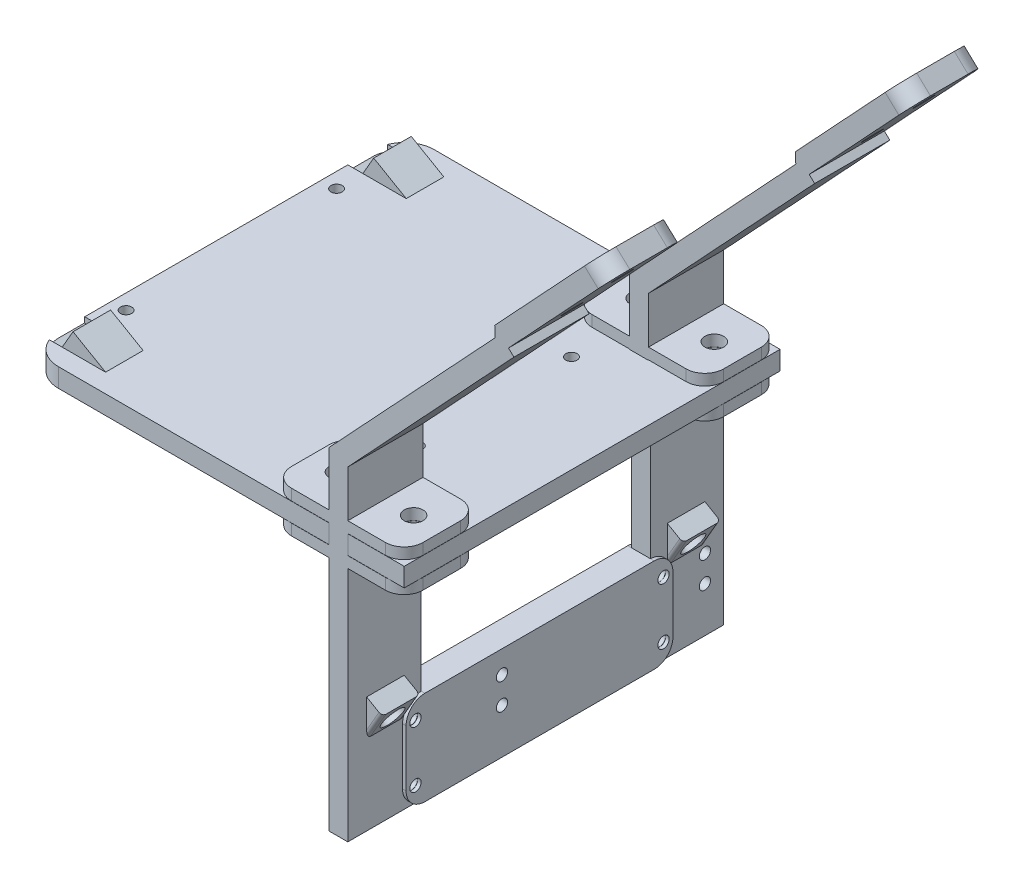
from build123d import *

# Parameters (mm, degrees)
BOSS_EXTRUDE1_DEPTH      = 177
SKETCH2_W                = 38.5
SKETCH2_H                = 131.411442955
CUT_EXTRUDE1_DEPTH       = 149
SKETCH3_R                = 1.5
CUT_EXTRUDE2_DEPTH       = 10
SKETCH4_W                = 20
SKETCH4_H                = 5
SKETCH4_W_2              = 80
BOSS_EXTRUDE2_DEPTH      = 50
SKETCH6_W                = 51.237784488
SKETCH6_H                = 73.001467873
CUT_EXTRUDE4_DEPTH       = 30
BOSS_EXTRUDE3_DEPTH      = 20
FILLET1_R                = 8
CUT_EXTRUDE5_DEPTH       = 251.361711368
SKETCH9_R                = 5
CUT_EXTRUDE6_DEPTH       = 3
SKETCH10_R               = 2.5
CUT_EXTRUDE7_DEPTH       = 235.893114528
FILLET2_R                = 5
SKETCH11_W               = 61
SKETCH11_H               = 41
CUT_EXTRUDE8_DEPTH       = 191.999951248
SKETCH13_R               = 2.5
BOSS_EXTRUDE4_DEPTH      = 3
BOSS_EXTRUDE5_DEPTH      = 5
SKETCH15_R               = 3
CUT_EXTRUDE10_DEPTH      = 231.810012314
SKETCH16_W               = 10
SKETCH16_H               = 9
CUT_EXTRUDE11_DEPTH      = 10
SKETCH17_W               = 10
SKETCH17_H               = 9
SKETCH17_R               = 3
BOSS_EXTRUDE6_DEPTH      = 5
SKETCH18_R               = 1.5
CUT_EXTRUDE12_DEPTH      = 195.856456522
SKETCH19_W               = 9.95
SKETCH19_H               = 0.05
SKETCH19_W_2             = 5
SKETCH19_W_3             = 0.05
SKETCH19_H_2             = 5
CUT_EXTRUDE14_DEPTH      = 20
CUT_EXTRUDE15_DEPTH      = 195.856456522
CUT_EXTRUDE15_DEPTH_BACK = 20
SKETCH13_2_R             = 2.5
CUT_EXTRUDE16_DEPTH      = 251.361711368
CHAMFER1_SIZE            = 2
CUT_EXTRUDE17_DEPTH      = 25
SKETCH24_R               = 1.5
CUT_EXTRUDE18_DEPTH      = 50
SKETCH25_R               = 1.5
BOSS_EXTRUDE7_DEPTH      = 1
FILLET3_R                = 1
CUT_EXTRUDE19_START      = -25
CUT_EXTRUDE19_DEPTH      = 25


# Read off the part's stored shape, not the designer's step: Cut-Extrude19
# Some blends are built 0.0001 mm under size
with BuildPart() as part:
    # Sketch1 → Boss-Extrude1 (new body)
    with BuildSketch(Plane.XY.offset(88.5)):
        Polygon((-30.689926203, -30.910916573), (-27.033157695, -34.320908373), (-73.429811407, -84.075228064), (-73.429811407, -166.075228064), (-78.429811407, -166.075228064), (-78.429811407, -82.105675686), align=None)
    extrude(amount=-BOSS_EXTRUDE1_DEPTH)

    # Sketch2 → Cut-Extrude1 (cut)
    with BuildSketch(Plane(origin=(-0.99756405, 0.930243526, 0), x_dir=(0, 0, 1), z_dir=(-0.7313537016191676, 0.6819983600625017, 0))):
        with Locations((-69.25, -109.243014075)):
            Rectangle(SKETCH2_W, SKETCH2_H)
        with Locations((69.25, -109.243014075)):
            Rectangle(SKETCH2_W, SKETCH2_H)
    extrude(amount=-CUT_EXTRUDE1_DEPTH, mode=Mode.SUBTRACT)

    # Sketch3 → Cut-Extrude2 (cut)
    with BuildSketch(Plane(origin=(-73.429811407, 0, 0), x_dir=(0, 0, -1), z_dir=(1, 0, 0))):
        with Locations(Location((45, -147.075228064, 0), (0, 0, 90))):
            Circle(SKETCH3_R)
        with Locations(Location((45, -154.075228064, 0), (0, 0, 90))):
            Circle(SKETCH3_R)
        with Locations(Location((-10, -147.075228064, 0), (0, 0, 90))):
            Circle(SKETCH3_R)
        with Locations(Location((-10, -154.075228064, 0), (0, 0, 90))):
            Circle(SKETCH3_R)
    extrude(amount=-CUT_EXTRUDE2_DEPTH, mode=Mode.SUBTRACT)

    # Sketch4 → Boss-Extrude2 (add, symmetric)
    with BuildSketch(Plane.XY):
        with Locations((-68.429811407, -97.575228064)):
            Rectangle(SKETCH4_W, SKETCH4_H)
        with Locations((-118.429811407, -97.575228064)):
            Rectangle(SKETCH4_W_2, SKETCH4_H)
    extrude(amount=BOSS_EXTRUDE2_DEPTH, both=True)

    # Sketch6 → Cut-Extrude4 (cut, symmetric)
    with BuildSketch(Plane.XY):
        with Locations((-52.810919163, -58.574494128)):
            Rectangle(SKETCH6_W, SKETCH6_H)
    extrude(amount=CUT_EXTRUDE4_DEPTH, both=True, mode=Mode.SUBTRACT)

    # Sketch7 → Boss-Extrude3 (add)
    with BuildSketch(Plane.XY.offset(50)):
        Polygon((-78.429811407, -74.774279758), (-78.429811407, -82.105675686), (-30.689926203, -30.910916573), (-3.4099918, -1.656768508), (-7.066760308, 1.753223292), align=None)
    boss_extrude3 = extrude(amount=-BOSS_EXTRUDE3_DEPTH)

    # Mirror2: Boss-Extrude3 across plane
    add(boss_extrude3.mirror(Plane.XY))

    # Fillet1
    fillet1_edges = [part.edges().sort_by_distance(p)[0] for p in [
        (-158.429811407, -97.575228064, 50),
        (-158.429811407, -97.575228064, -50),
    ]]
    fillet(fillet1_edges, radius=FILLET1_R)

    # Sketch8 → Cut-Extrude5 (cut, through all)
    with BuildSketch(Plane(origin=(0, 0, -50), x_dir=(-1, 0, 0), z_dir=(0, 0, -1))):
        Polygon((73.429811407, -79.676390507), (29.2272188, -32.274913293), (27.033157695, -34.320908373), (73.429811407, -84.075228064), align=None)
    extrude(amount=-CUT_EXTRUDE5_DEPTH, mode=Mode.SUBTRACT)

    # Sketch9 → Cut-Extrude6 (cut)
    with BuildSketch(Plane(origin=(-4.654332558, 4.340235327, 0), x_dir=(0, 0, 1), z_dir=(-0.7313537016191722, 0.6819983600624966, 0))):
        with Locations(Location((-40, -13.537292597, 0), (0, 0, 270))):
            Circle(SKETCH9_R)
        with Locations(Location((-40, -33.537292597, 0), (0, 0, 270))):
            Circle(SKETCH9_R)
        with Locations(Location((40, -33.537292597, 0), (0, 0, 270))):
            Circle(SKETCH9_R)
        with Locations(Location((40, -13.537292597, 0), (0, 0, 270))):
            Circle(SKETCH9_R)
    extrude(amount=-CUT_EXTRUDE6_DEPTH, mode=Mode.SUBTRACT)

    # Sketch10 → Cut-Extrude7 (cut, through all)
    with BuildSketch(Plane(origin=(-2.460271453, 2.294240246, 0), x_dir=(0, 0, 1), z_dir=(-0.7313537016191722, 0.6819983600624966, 0))):
        with Locations(Location((-40, -13.537292597, 0), (0, 0, 270))):
            Circle(SKETCH10_R)
        with Locations(Location((-40, -33.537292597, 0), (0, 0, 270))):
            Circle(SKETCH10_R)
        with Locations(Location((40, -13.537292597, 0), (0, 0, 270))):
            Circle(SKETCH10_R)
        with Locations(Location((40, -33.537292597, 0), (0, 0, 270))):
            Circle(SKETCH10_R)
    extrude(amount=-CUT_EXTRUDE7_DEPTH, mode=Mode.SUBTRACT)

    # Fillet2
    fillet2_edges = [part.edges().sort_by_distance(p)[0] for p in [
        (-5.238376054, 0.048227392, 50),
        (-5.238376054, 0.048227392, 30),
        (-5.238376054, 0.048227392, -30),
        (-5.238376054, 0.048227392, -50),
    ]]
    fillet(fillet2_edges, radius=FILLET2_R)

    # Sketch11 → Cut-Extrude8 (cut, through all)
    with BuildSketch(Plane.ZY.offset(78.429811407)):
        with Locations((0, -120.575228064)):
            Rectangle(SKETCH11_W, SKETCH11_H)
    extrude(amount=-CUT_EXTRUDE8_DEPTH, mode=Mode.SUBTRACT)

    # Sketch13 → Boss-Extrude4 (add)
    # profile 1 of 2: a face of its own
    with BuildSketch(Plane.XZ.offset(100.075228064)):
        with BuildLine():
            Line((-63.429811407, 50), (-88.429811407, 50))
            ThreePointArc((-88.429811407, 50), (-91.965345313, 48.535533906), (-93.429811407, 45))
            Line((-93.429811407, 45), (-93.429811407, 35))
            ThreePointArc((-93.429811407, 35), (-91.965345313, 31.464466094), (-88.429811407, 30))
            Line((-88.429811407, 30), (-63.429811407, 30))
            ThreePointArc((-63.429811407, 30), (-59.894277501, 31.464466094), (-58.429811407, 35))
            Line((-58.429811407, 35), (-58.429811407, 45))
            ThreePointArc((-58.429811407, 45), (-59.894277501, 48.535533906), (-63.429811407, 50))
        make_face()
        with Locations(Location((-65.929811407, 40, 0), (0, 0, 270))):
            Circle(SKETCH13_R, mode=Mode.SUBTRACT)
        with Locations(Location((-85.929811407, 40, 0), (0, 0, 270))):
            Circle(SKETCH13_R, mode=Mode.SUBTRACT)
    # profile 2 of 2: a face of its own
    with BuildSketch(Plane.XZ.offset(100.075228064)):
        with BuildLine():
            Line((-63.429811407, -30), (-88.429811407, -30))
            ThreePointArc((-88.429811407, -30), (-91.965345313, -31.464466094), (-93.429811407, -35))
            Line((-93.429811407, -35), (-93.429811407, -45))
            ThreePointArc((-93.429811407, -45), (-91.965345313, -48.535533906), (-88.429811407, -50))
            Line((-88.429811407, -50), (-63.429811407, -50))
            ThreePointArc((-63.429811407, -50), (-59.894277501, -48.535533906), (-58.429811407, -45))
            Line((-58.429811407, -45), (-58.429811407, -35))
            ThreePointArc((-58.429811407, -35), (-59.894277501, -31.464466094), (-63.429811407, -30))
        make_face()
        with Locations(Location((-65.929811407, -40, 0), (0, 0, 90))):
            Circle(SKETCH13_R, mode=Mode.SUBTRACT)
        with Locations(Location((-85.929811407, -40, 0), (0, 0, 90))):
            Circle(SKETCH13_R, mode=Mode.SUBTRACT)
    boss_extrude4 = extrude(amount=BOSS_EXTRUDE4_DEPTH)

    # Mirror3: Boss-Extrude4 across plane
    add(boss_extrude4.mirror(Plane.ZX.offset(-97.575228064)))

    # Sketch14 → Boss-Extrude5 (add, symmetric)
    with BuildSketch(Plane.XY.offset(40)):
        Polygon((-154.429811407, -95.075228064), (-142.882806023, -95.075228064), (-151.543060061, -90.075228064), align=None)
    boss_extrude5 = extrude(amount=BOSS_EXTRUDE5_DEPTH, both=True)

    # Sketch15 → Cut-Extrude10 (cut, through all)
    with BuildSketch(Plane(origin=(-74.653577168, 43.101262874, 0), x_dir=(0, 0, 1), z_dir=(-0.8660254037844434, 0.499999999999992, 0))):
        with Locations(Location((40, -158.278965786, 0), (0, 0, 270))):
            Circle(SKETCH15_R)
    cut_extrude10 = extrude(amount=-CUT_EXTRUDE10_DEPTH, mode=Mode.SUBTRACT)

    # Sketch16 → Cut-Extrude11 (cut)
    with BuildSketch(Plane(origin=(-74.653577168, 43.101262874, 0), x_dir=(0, 0, 1), z_dir=(-0.8660254037844434, 0.499999999999992, 0))):
        with Locations((40, -158.278965786)):
            Rectangle(SKETCH16_W, SKETCH16_H)
    cut_extrude11 = extrude(amount=CUT_EXTRUDE11_DEPTH, mode=Mode.SUBTRACT)

    # Sketch17 → Boss-Extrude6 (add)
    with BuildSketch(Plane(origin=(3.288709172, -1.898737126, 0), x_dir=(0, 0, 1), z_dir=(-0.8660254037844434, 0.499999999999992, 0))):
        with Locations((40, -158.278965786)):
            Rectangle(SKETCH17_W, SKETCH17_H)
        with Locations(Location((40, -158.278965786, 0), (0, 0, 270))):
            Circle(SKETCH17_R, mode=Mode.SUBTRACT)
    boss_extrude6 = extrude(amount=-BOSS_EXTRUDE6_DEPTH)

    # Mirror4: Boss-Extrude5, Cut-Extrude10, Cut-Extrude11, Boss-Extrude6 across plane
    add(boss_extrude5.mirror(Plane.XY))
    add(cut_extrude10.mirror(Plane.XY), mode=Mode.SUBTRACT)
    add(cut_extrude11.mirror(Plane.XY), mode=Mode.SUBTRACT)
    add(boss_extrude6.mirror(Plane.XY))

    # Sketch18 → Cut-Extrude12 (cut, through all)
    with BuildSketch(Plane.XZ.offset(100.075228064)):
        with Locations(Location((-154.429811407, 28, 0), (0, 0, 270))):
            Circle(SKETCH18_R)
        with Locations(Location((-84.429811407, 20.5, 0), (0, 0, 270))):
            Circle(SKETCH18_R)
        with Locations(Location((-84.429811407, -20.5, 0), (0, 0, 180))):
            Circle(SKETCH18_R)
        with Locations(Location((-154.429811407, -28, 0), (0, 0, 180))):
            Circle(SKETCH18_R)
    extrude(amount=-CUT_EXTRUDE12_DEPTH, mode=Mode.SUBTRACT)

    # Sketch19 → Cut-Extrude14 (cut)
    with BuildSketch(Plane(origin=(0, 0, -50), x_dir=(-1, 0, 0), z_dir=(0, 0, -1))):
        with Locations((68.404811407, -95.050228064)):
            Rectangle(SKETCH19_W, SKETCH19_H)
        with Locations((60.929811407, -95.050228064)):
            Rectangle(SKETCH19_W_2, SKETCH19_H)
        with Locations((60.929811407, -100.100228064)):
            Rectangle(SKETCH19_W_2, SKETCH19_H)
        with Locations((68.404811407, -100.100228064)):
            Rectangle(SKETCH19_W, SKETCH19_H)
        with Locations((73.404811407, -95.050228064)):
            Rectangle(SKETCH19_W_3, SKETCH19_H)
        with Locations((73.404811407, -97.575228064)):
            Rectangle(SKETCH19_W_3, SKETCH19_H_2)
        with Locations((73.404811407, -100.100228064)):
            Rectangle(SKETCH19_W_3, SKETCH19_H)
        with Locations((83.454811407, -100.100228064)):
            Rectangle(SKETCH19_W, SKETCH19_H)
        with Locations((78.454811407, -100.100228064)):
            Rectangle(SKETCH19_W_3, SKETCH19_H)
        with Locations((78.454811407, -97.575228064)):
            Rectangle(SKETCH19_W_3, SKETCH19_H_2)
        with Locations((78.454811407, -95.050228064)):
            Rectangle(SKETCH19_W_3, SKETCH19_H)
        with Locations((83.454811407, -95.050228064)):
            Rectangle(SKETCH19_W, SKETCH19_H)
        with Locations((90.929811407, -95.050228064)):
            Rectangle(SKETCH19_W_2, SKETCH19_H)
        with Locations((90.929811407, -100.100228064)):
            Rectangle(SKETCH19_W_2, SKETCH19_H)
    cut_extrude14 = extrude(amount=-CUT_EXTRUDE14_DEPTH, mode=Mode.SUBTRACT)

    # Mirror6: Cut-Extrude14 across plane
    add(cut_extrude14.mirror(Plane.XY), mode=Mode.SUBTRACT)

    # Sketch13<2> → Cut-Extrude15 (cut, two sides: drawn at the far end of the back side and taken through both)
    with BuildSketch(Plane.XZ.offset(100.075228064).offset(-CUT_EXTRUDE15_DEPTH_BACK)):
        with Locations(Location((-85.929811407, 40, 0), (0, 0, 90))):
            Circle(SKETCH13_2_R)
        with Locations(Location((-65.929811407, 40, 0), (0, 0, 90))):
            Circle(SKETCH13_2_R)
        with Locations(Location((-85.929811407, -40, 0), (0, 0, 90))):
            Circle(SKETCH13_2_R)
        with Locations(Location((-65.929811407, -40, 0), (0, 0, 90))):
            Circle(SKETCH13_2_R)
    extrude(amount=CUT_EXTRUDE15_DEPTH + CUT_EXTRUDE15_DEPTH_BACK, mode=Mode.SUBTRACT)

    # Sketch22 → Cut-Extrude16 (cut, through all)
    with BuildSketch(Plane(origin=(0, 0, -50), x_dir=(-1, 0, 0), z_dir=(0, 0, -1))):
        Polygon((34.346694711, -27.500924773), (32.883987308, -28.864921493), (76.967104004, -76.138276478), (78.429811407, -77.706838129), (78.429811407, -74.774279758), align=None)
    extrude(amount=-CUT_EXTRUDE16_DEPTH, mode=Mode.SUBTRACT)

    # Chamfer1
    chamfer1_edges = [part.edges().sort_by_distance(p)[0] for p in [
        (-32.883987308, -28.864921493, 40),
        (-32.883987308, -28.864921493, -40),
    ]]
    chamfer(chamfer1_edges, length=CHAMFER1_SIZE - 0.0001)  # a hair under: the kernel refuses the full size

    # Sketch23 → Cut-Extrude17 (cut, symmetric)
    with BuildSketch(Plane(origin=(0, -95.075228064, 0), x_dir=(1, 0, 0), z_dir=(0, 1, 0))):
        Polygon((-73.379811407, -30), (-73.379811407, -29.95), (-78.479811407, -29.95), (-78.479811407, -30), (-78.429811407, -30), (-73.429811407, -30), align=None)
        Polygon((-73.379811407, 30), (-73.379811407, 29.95), (-78.479811407, 29.95), (-78.479811407, 30), (-78.429811407, 30), (-73.429811407, 30), align=None)
    extrude(amount=CUT_EXTRUDE17_DEPTH, both=True, mode=Mode.SUBTRACT)


with BuildPart() as cut_extrude17_piece_1:
    # of the separate pieces the step leaves, piece 1, a body of its own (cut_extrude17_pieces)
    add(part.part.solids().sort_by_distance((-34.247915828, -30.327555761, -50))[0])

    # Sketch24 → Cut-Extrude18 (cut)
    with BuildSketch(Plane.ZY.offset(78.429811407)):
        with Locations(Location((-33, -146.075228064, 0), (0, 0, 270))):
            Circle(SKETCH24_R)
        with Locations(Location((-33, -161.075228064, 0), (0, 0, 270))):
            Circle(SKETCH24_R)
        with Locations(Location((33, -161.075228064, 0), (0, 0, 270))):
            Circle(SKETCH24_R)
        with Locations(Location((33, -146.075228064, 0), (0, 0, 270))):
            Circle(SKETCH24_R)
    extrude(amount=-CUT_EXTRUDE18_DEPTH, mode=Mode.SUBTRACT)

    # Sketch25 → Boss-Extrude7 (add)
    with BuildSketch(Plane.ZY.offset(78.429811407)):
        with BuildLine():
            Line((-30.5, -141.075228064), (30.5, -141.075228064))
            ThreePointArc((30.5, -141.075228064), (34.035533906, -142.539694158), (35.5, -146.075228064))
            Line((35.5, -146.075228064), (35.5, -161.075228064))
            ThreePointArc((35.5, -161.075228064), (34.035533906, -164.61076197), (30.5, -166.075228064))
            Line((30.5, -166.075228064), (-30.5, -166.075228064))
            ThreePointArc((-30.5, -166.075228064), (-34.035533906, -164.61076197), (-35.5, -161.075228064))
            Line((-35.5, -161.075228064), (-35.5, -146.075228064))
            ThreePointArc((-35.5, -146.075228064), (-34.035533906, -142.539694158), (-30.5, -141.075228064))
        make_face()
        with Locations(Location((-33, -146.075228064, 0), (0, 0, 270))):
            Circle(SKETCH25_R, mode=Mode.SUBTRACT)
        with Locations(Location((-33, -161.075228064, 0), (0, 0, 270))):
            Circle(SKETCH25_R, mode=Mode.SUBTRACT)
        with Locations(Location((33, -146.075228064, 0), (0, 0, 270))):
            Circle(SKETCH25_R, mode=Mode.SUBTRACT)
        with Locations(Location((33, -161.075228064, 0), (0, 0, 270))):
            Circle(SKETCH25_R, mode=Mode.SUBTRACT)
        with Locations(Location((10, -147.075228064, 0), (0, 0, 90))):
            Circle(SKETCH25_R, mode=Mode.SUBTRACT)
        with Locations(Location((10, -154.075228064, 0), (0, 0, 90))):
            Circle(SKETCH25_R, mode=Mode.SUBTRACT)
    boss_extrude7 = extrude(amount=BOSS_EXTRUDE7_DEPTH)

    # Mirror7: Boss-Extrude7 across plane
    add(boss_extrude7.mirror(Plane(origin=(-75.929811407, 0, 0), x_dir=(0, 0, 1), z_dir=(1, 0, 0))))

    # Fillet3
    # the kernel refuses this fillet: 1 mm, written as the material it takes off along each edge
    with BuildSketch(Plane(origin=(-74.169818251, -146.060842102, -35), x_dir=(-0.8660254037844433, 0.49999999999999195, 0), z_dir=(0.499999999999992, 0.8660254037844434, 0))) as fillet3_piece_1_section:
        with BuildLine():
            CenterArc((FILLET3_R, -FILLET3_R), FILLET3_R, 90, 90)
            Line((0, -FILLET3_R), (0, 0))
            Line((0, 0), (FILLET3_R, 0))
        make_face()
    fillet3_piece_1 = extrude(amount=12.298343098, mode=Mode.PRIVATE)
    fillet3_piece_1 = split(fillet3_piece_1, bisect_by=Plane(origin=(-73.429811407, -139.757269154, -35.233121539), z_dir=(1, 0, 0)), keep=Keep.TOP, mode=Mode.PRIVATE)
    fillet3_piece_1 = fillet3_piece_1 - Plane(origin=(-70.784836238, -146.075228064, -30.5), x_dir=(0, 0, -1), z_dir=(-1, 0, 0)) * Cylinder(5, 29, mode=Mode.PRIVATE)
    add(fillet3_piece_1, mode=Mode.SUBTRACT)
    with BuildSketch(Plane(origin=(-68.020646702, -135.410164555, -45), x_dir=(-0.8660254037844433, 0.4999999999999919, 0), z_dir=(-0.499999999999992, -0.8660254037844434, 0))) as fillet3_piece_2_section:
        with BuildLine():
            CenterArc((FILLET3_R, -FILLET3_R), FILLET3_R, 90, 90)
            Line((0, -FILLET3_R), (0, 0))
            Line((0, 0), (FILLET3_R, 0))
        make_face()
    fillet3_piece_2 = extrude(amount=13.318329411, mode=Mode.PRIVATE)
    fillet3_piece_2 = split(fillet3_piece_2, bisect_by=Plane(origin=(-73.429811407, -139.821295864, -44.769043645), z_dir=(1, 0, 0)), keep=Keep.TOP, mode=Mode.PRIVATE)
    add(fillet3_piece_2, mode=Mode.SUBTRACT)
    with BuildSketch(Plane(origin=(-74.169818251, -146.060842102, 35), x_dir=(0, 0, 1), z_dir=(0.499999999999992, 0.8660254037844434, 0))) as fillet3_piece_3_section:
        with BuildLine():
            CenterArc((FILLET3_R, -FILLET3_R), FILLET3_R, 90, 90)
            Line((0, -FILLET3_R), (0, 0))
            Line((0, 0), (FILLET3_R, 0))
        make_face()
    fillet3_piece_3 = extrude(amount=12.298343098, mode=Mode.PRIVATE)
    fillet3_piece_3 = split(fillet3_piece_3, bisect_by=Plane(origin=(-73.429811407, -139.757269177, 35.233121539), z_dir=(1, 0, 0)), keep=Keep.TOP, mode=Mode.PRIVATE)
    fillet3_piece_3 = fillet3_piece_3 - Plane(origin=(-70.784836252, -146.075228064, 30.5), x_dir=(0, 1, 0), z_dir=(-1, 0, 0)) * Cylinder(5, 29, mode=Mode.PRIVATE)
    add(fillet3_piece_3, mode=Mode.SUBTRACT)
    with BuildSketch(Plane(origin=(-68.020646702, -135.410164555, 45), x_dir=(0, 0, -1), z_dir=(-0.499999999999992, -0.8660254037844434, 0))) as fillet3_piece_4_section:
        with BuildLine():
            CenterArc((FILLET3_R, -FILLET3_R), FILLET3_R, 90, 90)
            Line((0, -FILLET3_R), (0, 0))
            Line((0, 0), (FILLET3_R, 0))
        make_face()
    fillet3_piece_4 = extrude(amount=13.318329411, mode=Mode.PRIVATE)
    fillet3_piece_4 = split(fillet3_piece_4, bisect_by=Plane(origin=(-73.429811407, -139.821295864, 44.769043645), z_dir=(1, 0, 0)), keep=Keep.TOP, mode=Mode.PRIVATE)
    add(fillet3_piece_4, mode=Mode.SUBTRACT)

    # Cut-Extrude19 outline → Cut-Extrude19 (cut)
    with BuildSketch(Plane.XZ.offset(166.075228064).offset(CUT_EXTRUDE19_START)):
        Polygon((-73.429811407, -35.5), (-73.379811407, -35.5), (-73.379811407, -30.5), (-78.479811407, -30.5), (-78.479811407, -35.5), (-78.429811407, -35.5), (-78.429811407, -30.55), (-73.429811407, -30.55), align=None)
        Polygon((-73.379811407, 30.5), (-73.379811407, 35.5), (-73.429811407, 35.5), (-73.429811407, 30.55), (-78.429811407, 30.55), (-78.429811407, 35.5), (-78.479811407, 35.5), (-78.479811407, 30.5), align=None)
    extrude(amount=CUT_EXTRUDE19_DEPTH, mode=Mode.SUBTRACT)


with BuildPart() as cut_extrude17_piece_2:
    # of the separate pieces the step leaves, piece 2, a body of its own (cut_extrude17_pieces)
    add(part.part.solids().sort_by_distance((-78.479811407, -100.075228064, -50))[0])


solid = Compound([cut_extrude17_piece_1.part, cut_extrude17_piece_2.part])
